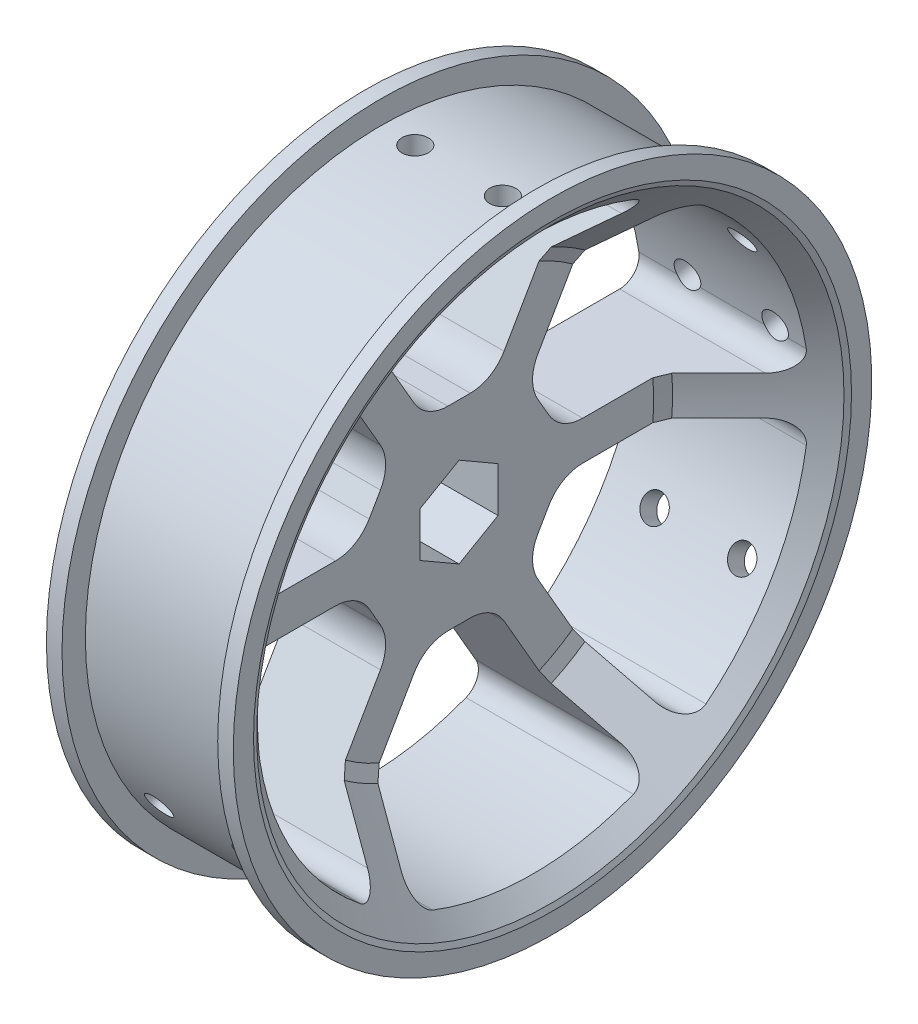
from build123d import *

# Parameters (mm, degrees)
SKETCH2_R               = 48.26
BOSS_EXTRUDE1_DEPTH     = 12.7
SKETCH3_R               = 52.07
BOSS_EXTRUDE2_DEPTH     = 2.54
CUT_EXTRUDE1_DEPTH      = 76.198586423
CUT_EXTRUDE1_DEPTH_BACK = 76.198586423
SKETCH10_R              = 48.26
CUT_EXTRUDE5_DEPTH      = 15.24
CUT_EXTRUDE5_DRAFT      = -45
CHAMFER2_SIZE           = 0.508
CHAMFER3_SIZE           = 1.27
CUT_EXTRUDE6_DEPTH      = 76.198586423
CIRPATTERN5_COUNT       = 6
FILLET2_R               = 6.35
CUT_EXTRUDE7_REACH      = 129.671
CUT_EXTRUDE7_END_RADIUS = 45.085
SKETCH8_R               = 2.1463


with BuildPart() as part:
    # Sketch2 → Boss-Extrude1 (new, symmetric)
    with BuildSketch(Plane(origin=(0, 0, 0), x_dir=(0, 0, -1), z_dir=(1, 0, 0))):
        Circle(SKETCH2_R)
    extrude(amount=BOSS_EXTRUDE1_DEPTH, both=True)

    # Sketch3 → Boss-Extrude2 (add)
    with BuildSketch(Plane.ZY.offset(12.7)):
        Circle(SKETCH3_R)
    boss_extrude2 = extrude(amount=BOSS_EXTRUDE2_DEPTH)

    # Mirror1: Boss-Extrude2 across plane
    add(boss_extrude2.mirror(Plane(origin=(0, 0, 0), x_dir=(0, 0, 1), z_dir=(1, 0, 0))))

    # Sketch4 → Cut-Extrude1 (cut, two sides: drawn at the far end of the back side and taken through both)
    with BuildSketch(Plane(origin=(0, 0, 0), x_dir=(0, 0, -1), z_dir=(1, 0, 0)).offset(-CUT_EXTRUDE1_DEPTH_BACK)):
        Polygon((0, 7.332348419), (-6.35, 3.666174209), (-6.35, -3.666174209), (0, -7.332348419), (6.35, -3.666174209), (6.35, 3.666174209), align=None)
    extrude(amount=CUT_EXTRUDE1_DEPTH + CUT_EXTRUDE1_DEPTH_BACK, mode=Mode.SUBTRACT)


with BuildPart() as cut_extrude5_tool:
    # Sketch10 → Cut-Extrude5 (with draft: the straight prism first)
    with BuildSketch(Plane(origin=(15.24, 0, 0), x_dir=(0, 0, -1), z_dir=(1, 0, 0))):
        with Locations(Location((0, 0, 0), (0, 0, 180))):
            Circle(SKETCH10_R)
    extrude(amount=-CUT_EXTRUDE5_DEPTH)
    # Cut-Extrude5: the draft: its side faces are tilted about the plane it starts from
    cut_extrude5_sides = [cut_extrude5_tool.faces().sort_by_distance(p)[0] for p in [
        (7.62, 0, -48.26),
    ]]
    draft(cut_extrude5_sides, Plane(origin=(15.24, 0, 0), x_dir=(0, 0, -1), z_dir=(1, 0, 0)), CUT_EXTRUDE5_DRAFT)


with BuildPart() as part_1:
    add(part.part)

    # Cut-Extrude5: cut by cut_extrude5_tool
    add(cut_extrude5_tool.part, mode=Mode.SUBTRACT)

    # Chamfer2
    chamfer2_edges = [part_1.edges().sort_by_distance(p)[0] for p in [
        (15.24, 0, -48.26),
    ]]
    chamfer(chamfer2_edges, length=CHAMFER2_SIZE)

    # Chamfer3
    chamfer3_edges = [part_1.edges().sort_by_distance(p)[0] for p in [
        (0, 0, -33.02),
    ]]
    chamfer(chamfer3_edges, length=CHAMFER3_SIZE)

    # Sketch11 → Cut-Extrude6 (cut, symmetric)
    with BuildSketch(Plane(origin=(0, 0, 0), x_dir=(0, 0, -1), z_dir=(1, 0, 0))):
        with BuildLine():
            ThreePointArc((-16.366373356, 42.009511401), (-18.209327611, 40.103478278), (-17.963442509, 37.463595105))
            Line((-17.963442509, 37.463595105), (-5.499261314, 15.875))
            Line((-5.499261314, 15.875), (5.499261314, 15.875))
            Line((5.499261314, 15.875), (17.963442509, 37.463595105))
            ThreePointArc((17.963442509, 37.463595105), (18.209327611, 40.103478278), (16.366373356, 42.009511401))
            ThreePointArc((16.366373356, 42.009511401), (0, 45.085), (-16.366373356, 42.009511401))
        make_face()
    cut_extrude6 = extrude(amount=CUT_EXTRUDE6_DEPTH, both=True, mode=Mode.SUBTRACT)

    # CirPattern5: Cut-Extrude6 ×6 about axis
    cirpattern5_axis = Axis((0, 0, 0), (1, 0, 0))
    for i in range(1, CIRPATTERN5_COUNT):
        add(cut_extrude6.rotate(cirpattern5_axis, i * 360 / CIRPATTERN5_COUNT), mode=Mode.SUBTRACT)

    # Fillet2
    fillet2_edges = [part_1.edges().sort_by_distance(p)[0] for p in [
        (-7.62, 12.7, 10.998522628),
        (-7.62, 3.175, 16.497783942),
        (-7.62, -3.175, 16.497783942),
        (-7.62, -12.7, 10.998522628),
        (-7.62, -12.7, -10.998522628),
        (-7.62, -3.175, -16.497783942),
        (-7.62, -15.875, 5.499261314),
        (-7.62, -15.875, -5.499261314),
        (-7.62, 15.875, -5.499261314),
        (-7.62, 15.875, 5.499261314),
        (-7.62, 3.175, -16.497783942),
        (-7.62, 12.7, -10.998522628),
    ]]
    fillet(fillet2_edges, radius=FILLET2_R)

    # Cut-Extrude7: up to this cylinder (the profile starts outside it)
    cut_extrude7_end = Plane(origin=(0, 0, 0), z_dir=(1, 0, 0)) * Cylinder(CUT_EXTRUDE7_END_RADIUS, 364.7995, mode=Mode.PRIVATE)
    # Sketch8 → Cut-Extrude7 (cut, up to the surface)
    with BuildSketch(Plane(origin=(0, 63.5, 0), x_dir=(1, 0, 0), z_dir=(0, 1, 0)), mode=Mode.PRIVATE) as cut_extrude7_sk1:
        with Locations(Location((-7.14375, 0, 0), (0, 0, 270))):
            Circle(SKETCH8_R)
    cut_extrude7_tool1 = extrude(cut_extrude7_sk1.sketch, amount=-CUT_EXTRUDE7_REACH, mode=Mode.PRIVATE) - cut_extrude7_end
    add(cut_extrude7_tool1.solids().sort_by_distance((-7.14375, 63.5, 0))[0], mode=Mode.SUBTRACT)
    # Sketch8 → Cut-Extrude7 (cut, up to the surface)
    with BuildSketch(Plane(origin=(0, 63.5, 0), x_dir=(1, 0, 0), z_dir=(0, 1, 0)), mode=Mode.PRIVATE) as cut_extrude7_sk2:
        with Locations(Location((7.14375, 0, 0), (0, 0, 270))):
            Circle(SKETCH8_R)
    cut_extrude7_tool2 = extrude(cut_extrude7_sk2.sketch, amount=-CUT_EXTRUDE7_REACH, mode=Mode.PRIVATE) - cut_extrude7_end
    add(cut_extrude7_tool2.solids().sort_by_distance((7.14375, 63.5, 0))[0], mode=Mode.SUBTRACT)

    # CirPattern6: read off the stored shape, not the designer's step
    # CirPattern6: loft between two sections, ruled curve by curve
    cirpattern6_from = [
        Edge.make_three_point_arc((-7.14375, 24.375678093, -37.927312925), (-4.99745, 22.516927768, -39.000462925), (-7.14375, 20.658177444, -40.073612925)),
        Edge.make_three_point_arc((-7.14375, 20.658177444, -40.073612925), (-9.29005, 22.516927768, -39.000462925), (-7.14375, 24.375678093, -37.927312925)),
    ]
    cirpattern6_to = [
        Edge.make_three_point_arc((-7.14375, 25.988753634, -40.72124172), (-4.99745, 24.13000331, -41.79439172), (-7.14375, 22.271252986, -42.86754172)),
        Edge.make_three_point_arc((-7.14375, 22.271252986, -42.86754172), (-9.29005, 24.13000331, -41.79439172), (-7.14375, 25.988753634, -40.72124172)),
    ]
    cirpattern6 = Solid(Shell([*[Face.make_surface_from_curves(cirpattern6_from[k], cirpattern6_to[k]) for k in range(2)], Face(Wire(cirpattern6_from)), Face(Wire(cirpattern6_to))]))
    add(cirpattern6, mode=Mode.SUBTRACT)

    # CirPattern6 2: loft between two sections, ruled curve by curve
    cirpattern6_2_from = [
        Edge.make_three_point_arc((-7.14375, -24.375678093, 37.927312925), (-4.99745, -22.516927768, 39.000462925), (-7.14375, -20.658177444, 40.073612925)),
        Edge.make_three_point_arc((-7.14375, -20.658177444, 40.073612925), (-9.29005, -22.516927768, 39.000462925), (-7.14375, -24.375678093, 37.927312925)),
    ]
    cirpattern6_2_to = [
        Edge.make_three_point_arc((-7.14375, -25.988753634, 40.72124172), (-4.99745, -24.13000331, 41.79439172), (-7.14375, -22.271252986, 42.86754172)),
        Edge.make_three_point_arc((-7.14375, -22.271252986, 42.86754172), (-9.29005, -24.13000331, 41.79439172), (-7.14375, -25.988753634, 40.72124172)),
    ]
    cirpattern6_2 = Solid(Shell([*[Face.make_surface_from_curves(cirpattern6_2_from[k], cirpattern6_2_to[k]) for k in range(2)], Face(Wire(cirpattern6_2_from)), Face(Wire(cirpattern6_2_to))]))
    add(cirpattern6_2, mode=Mode.SUBTRACT)

    # CirPattern6 3: loft between two sections, ruled curve by curve
    cirpattern6_3_from = [
        Edge.make_three_point_arc((7.14375, -24.375678093, 37.927312925), (9.29005, -22.516927768, 39.000462925), (7.14375, -20.658177444, 40.073612925)),
        Edge.make_three_point_arc((7.14375, -20.658177444, 40.073612925), (4.99745, -22.516927768, 39.000462925), (7.14375, -24.375678093, 37.927312925)),
    ]
    cirpattern6_3_to = [
        Edge.make_three_point_arc((7.14375, -25.988753634, 40.72124172), (9.29005, -24.13000331, 41.79439172), (7.14375, -22.271252986, 42.86754172)),
        Edge.make_three_point_arc((7.14375, -22.271252986, 42.86754172), (4.99745, -24.13000331, 41.79439172), (7.14375, -25.988753634, 40.72124172)),
    ]
    cirpattern6_3 = Solid(Shell([*[Face.make_surface_from_curves(cirpattern6_3_from[k], cirpattern6_3_to[k]) for k in range(2)], Face(Wire(cirpattern6_3_from)), Face(Wire(cirpattern6_3_to))]))
    add(cirpattern6_3, mode=Mode.SUBTRACT)

    # CirPattern6 4: loft between two sections, ruled curve by curve
    cirpattern6_4_from = [
        Edge.make_three_point_arc((7.14375, 24.375678093, -37.927312925), (9.29005, 22.516927768, -39.000462925), (7.14375, 20.658177444, -40.073612925)),
        Edge.make_three_point_arc((7.14375, 20.658177444, -40.073612925), (4.99745, 22.516927768, -39.000462925), (7.14375, 24.375678093, -37.927312925)),
    ]
    cirpattern6_4_to = [
        Edge.make_three_point_arc((7.14375, 25.988753634, -40.72124172), (9.29005, 24.13000331, -41.79439172), (7.14375, 22.271252986, -42.86754172)),
        Edge.make_three_point_arc((7.14375, 22.271252986, -42.86754172), (4.99745, 24.13000331, -41.79439172), (7.14375, 25.988753634, -40.72124172)),
    ]
    cirpattern6_4 = Solid(Shell([*[Face.make_surface_from_curves(cirpattern6_4_from[k], cirpattern6_4_to[k]) for k in range(2)], Face(Wire(cirpattern6_4_from)), Face(Wire(cirpattern6_4_to))]))
    add(cirpattern6_4, mode=Mode.SUBTRACT)

    # CirPattern6 5: loft between two sections, ruled curve by curve
    cirpattern6_5_from = [
        Edge.make_three_point_arc((7.14375, -20.658177444, -40.073612925), (9.29005, -22.516927768, -39.000462925), (7.14375, -24.375678093, -37.927312925)),
        Edge.make_three_point_arc((7.14375, -24.375678093, -37.927312925), (4.99745, -22.516927768, -39.000462925), (7.14375, -20.658177444, -40.073612925)),
    ]
    cirpattern6_5_to = [
        Edge.make_three_point_arc((7.14375, -22.271252986, -42.86754172), (9.29005, -24.13000331, -41.79439172), (7.14375, -25.988753634, -40.72124172)),
        Edge.make_three_point_arc((7.14375, -25.988753634, -40.72124172), (4.99745, -24.13000331, -41.79439172), (7.14375, -22.271252986, -42.86754172)),
    ]
    cirpattern6_5 = Solid(Shell([*[Face.make_surface_from_curves(cirpattern6_5_from[k], cirpattern6_5_to[k]) for k in range(2)], Face(Wire(cirpattern6_5_from)), Face(Wire(cirpattern6_5_to))]))
    add(cirpattern6_5, mode=Mode.SUBTRACT)

    # CirPattern6 6: loft between two sections, ruled curve by curve
    cirpattern6_6_from = [
        Edge.make_three_point_arc((-7.14375, -20.658177444, -40.073612925), (-4.99745, -22.516927768, -39.000462925), (-7.14375, -24.375678093, -37.927312925)),
        Edge.make_three_point_arc((-7.14375, -24.375678093, -37.927312925), (-9.29005, -22.516927768, -39.000462925), (-7.14375, -20.658177444, -40.073612925)),
    ]
    cirpattern6_6_to = [
        Edge.make_three_point_arc((-7.14375, -22.271252986, -42.86754172), (-4.99745, -24.13000331, -41.79439172), (-7.14375, -25.988753634, -40.72124172)),
        Edge.make_three_point_arc((-7.14375, -25.988753634, -40.72124172), (-9.29005, -24.13000331, -41.79439172), (-7.14375, -22.271252986, -42.86754172)),
    ]
    cirpattern6_6 = Solid(Shell([*[Face.make_surface_from_curves(cirpattern6_6_from[k], cirpattern6_6_to[k]) for k in range(2)], Face(Wire(cirpattern6_6_from)), Face(Wire(cirpattern6_6_to))]))
    add(cirpattern6_6, mode=Mode.SUBTRACT)

    # CirPattern6 7: loft between two sections, ruled curve by curve
    cirpattern6_7_from = [
        Edge.make_three_point_arc((7.14375, 9.899424903, -43.782379392), (9.29005, 7.785732023, -44.155080475), (7.14375, 5.672039143, -44.527781559)),
        Edge.make_three_point_arc((7.14375, 5.672039143, -44.527781559), (4.99745, 7.785732023, -44.155080475), (7.14375, 9.899424903, -43.782379392)),
    ]
    cirpattern6_7_to = [
        Edge.make_three_point_arc((7.14375, 10.493955084, -47.154127596), (9.29005, 8.380262204, -47.52682868), (7.14375, 6.266569324, -47.899529764)),
        Edge.make_three_point_arc((7.14375, 6.266569324, -47.899529764), (4.99745, 8.380262204, -47.52682868), (7.14375, 10.493955084, -47.154127596)),
    ]
    cirpattern6_7 = Solid(Shell([*[Face.make_surface_from_curves(cirpattern6_7_from[k], cirpattern6_7_to[k]) for k in range(2)], Face(Wire(cirpattern6_7_from)), Face(Wire(cirpattern6_7_to))]))
    add(cirpattern6_7, mode=Mode.SUBTRACT)

    # CirPattern6 8: loft between two sections, ruled curve by curve
    cirpattern6_8_from = [
        Edge.make_three_point_arc((-7.14375, 9.899424903, -43.782379392), (-4.99745, 7.785732023, -44.155080475), (-7.14375, 5.672039143, -44.527781559)),
        Edge.make_three_point_arc((-7.14375, 5.672039143, -44.527781559), (-9.29005, 7.785732023, -44.155080475), (-7.14375, 9.899424903, -43.782379392)),
    ]
    cirpattern6_8_to = [
        Edge.make_three_point_arc((-7.14375, 10.493955084, -47.154127596), (-4.99745, 8.380262204, -47.52682868), (-7.14375, 6.266569324, -47.899529764)),
        Edge.make_three_point_arc((-7.14375, 6.266569324, -47.899529764), (-9.29005, 8.380262204, -47.52682868), (-7.14375, 10.493955084, -47.154127596)),
    ]
    cirpattern6_8 = Solid(Shell([*[Face.make_surface_from_curves(cirpattern6_8_from[k], cirpattern6_8_to[k]) for k in range(2)], Face(Wire(cirpattern6_8_from)), Face(Wire(cirpattern6_8_to))]))
    add(cirpattern6_8, mode=Mode.SUBTRACT)


solid = part_1.part
